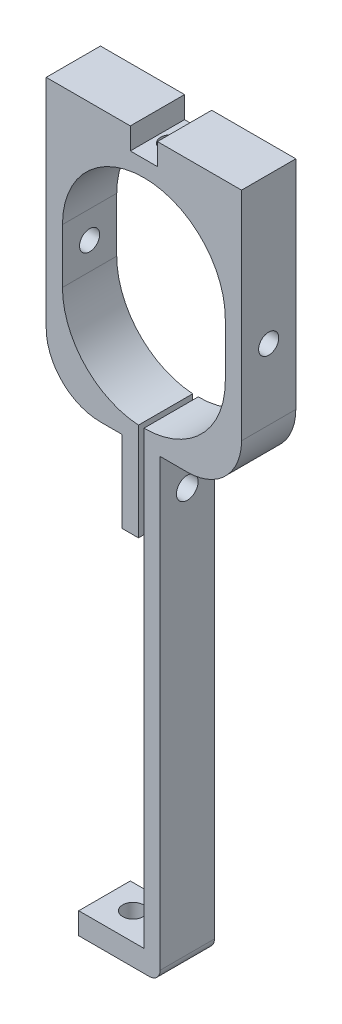
from build123d import *

# Parameters (mm, degrees)
BOSS_EXTRUDE2_DEPTH      = 10
CUT_EXTRUDE2_DEPTH       = 90.877694674
CUT_EXTRUDE2_DEPTH_BACK  = 90.877694674
SKETCH5_W                = 11
SKETCH5_H                = 67.407766248
CUT_EXTRUDE3_DEPTH       = 87.446515257
CUT_EXTRUDE3_DEPTH_BACK  = 87.446515257
SKETCH16_R               = 1.85
FILLET16_R               = 15
CUT_EXTRUDE20_DEPTH      = 92.021975369
CUT_EXTRUDE20_DEPTH_BACK = 92.021975369
SKETCH45_R               = 1.85
SKETCH52_W               = 15
SKETCH52_H               = 10
BOSS_EXTRUDE25_DEPTH     = 4
FILLET17_R               = 10
FILLET18_R               = 2
SKETCH53_R               = 1.9
CUT_EXTRUDE25_DEPTH      = 10
SKETCH55_W               = 0.5
SKETCH55_H               = 4
CUT_EXTRUDE28_DEPTH      = 10
SKETCH56_W               = 10
SKETCH56_H               = 4
BOSS_EXTRUDE26_DEPTH     = 36
SKETCH57_R               = 1.9
CUT_EXTRUDE29_DEPTH      = 36
SKETCH59_W               = 5
SKETCH59_H               = 10
CUT_EXTRUDE31_DEPTH      = 4
CUT_EXTRUDE32_DEPTH      = 91.05553843
CUT_EXTRUDE32_DEPTH_BACK = 91.05553843
SKETCH60_R               = 2


with BuildPart() as part:
    # Sketch2 → Boss-Extrude2 (new body)
    with BuildSketch(Plane.XY):
        Polygon((18, -3), (33, -3), (33, 43), (-3, 43), (-3, -3), (11, -3), (11, -83), (18, -83), align=None)
        Polygon((15, 0), (30, 0), (30, 40), (0, 40), (0, 0), (14, 0), (14, -80), (15, -80), align=None, mode=Mode.SUBTRACT)
    extrude(amount=BOSS_EXTRUDE2_DEPTH)

    # Sketch5 → Cut-Extrude2 (cut, two sides: drawn at the far end of the back side and taken through both)
    with BuildSketch(Plane.XY.offset(10).offset(-CUT_EXTRUDE2_DEPTH_BACK)):
        with Locations((9.5, -51.703883124)):
            Rectangle(SKETCH5_W, SKETCH5_H)
    extrude(amount=CUT_EXTRUDE2_DEPTH + CUT_EXTRUDE2_DEPTH_BACK, mode=Mode.SUBTRACT)

    # Sketch16 → Cut-Extrude3 (cut, two sides: drawn at the far end of the back side and taken through both)
    with BuildSketch(Plane.ZY.offset(-11).offset(-CUT_EXTRUDE3_DEPTH_BACK)):
        with Locations((5, -10.5)):
            Circle(SKETCH16_R)
    extrude(amount=CUT_EXTRUDE3_DEPTH + CUT_EXTRUDE3_DEPTH_BACK, mode=Mode.SUBTRACT)

    # Fillet16
    # the kernel refuses this fillet: 15 mm, written as the material it adds along each edge
    with BuildSketch(Plane(origin=(0, 40, 0), x_dir=(0, -1, 0), z_dir=(0, 0, 1)), Plane(origin=(30, 40, 0), x_dir=(-1, 0, 0), z_dir=(0, 0, 1)), Plane(origin=(30, 0, 0), x_dir=(0, 1, 0), z_dir=(0, 0, 1))) as fillet16_piece_1:
        with BuildLine():
            CenterArc((FILLET16_R, FILLET16_R), FILLET16_R, 180, 90)
            Line((0, FILLET16_R), (-FILLET16_R * 0.02, FILLET16_R))
            Line((-FILLET16_R * 0.02, FILLET16_R), (-FILLET16_R * 0.02, -FILLET16_R * 0.02))
            Line((-FILLET16_R * 0.02, -FILLET16_R * 0.02), (FILLET16_R, -FILLET16_R * 0.02))
            Line((FILLET16_R, -FILLET16_R * 0.02), (FILLET16_R, 0))
        make_face()
    extrude(amount=10)
    with BuildSketch(Plane(origin=(0, 0, 0), x_dir=(1, 0, 0), z_dir=(0, 0, 1))) as fillet16_piece_2:
        with BuildLine():
            CenterArc((15, 14.966629547), FILLET16_R, 180, 86.177446271)
            Line((0, 14.966629547), (-0.3, 14.966629547))
            Line((-0.3, 14.966629547), (-0.3, 0))
            Line((-0.3, 0), (0, -0.3))
            ThreePointArc((0, -0.3), (7, -0.3), (13.98, -0.299332591))
            Line((13.98, -0.299332591), (14, 0))
        make_face()
    extrude(amount=10)

    # Sketch45 → Cut-Extrude20 (cut, two sides: drawn at the far end of the back side and taken through both)
    with BuildSketch(Plane.ZY.offset(3).offset(-CUT_EXTRUDE20_DEPTH_BACK)):
        with Locations((5, 20)):
            Circle(SKETCH45_R)
    extrude(amount=CUT_EXTRUDE20_DEPTH + CUT_EXTRUDE20_DEPTH_BACK, mode=Mode.SUBTRACT)

    # Sketch52 → Boss-Extrude25 (add)
    with BuildSketch(Plane.XZ.offset(83)):
        with Locations((10.5, 5)):
            Rectangle(SKETCH52_W, SKETCH52_H)
    extrude(amount=BOSS_EXTRUDE25_DEPTH)

    # Fillet17
    fillet17_edges = [part.edges().sort_by_distance(p)[0] for p in [
        (-3, -3, 5),
        (33, -3, 5),
    ]]
    fillet(fillet17_edges, radius=FILLET17_R)

    # Fillet18
    fillet18_edges = [part.edges().sort_by_distance(p)[0] for p in [
        (18, -87, 5),
    ]]
    fillet(fillet18_edges, radius=FILLET18_R)

    # Sketch53 → Cut-Extrude25 (cut)
    with BuildSketch(Plane.XZ.offset(87)):
        with Locations(Location((8, 5, 0), (0, 0, 270))):
            Circle(SKETCH53_R)
    extrude(amount=-CUT_EXTRUDE25_DEPTH, mode=Mode.SUBTRACT)

    # Sketch55 → Cut-Extrude28 (cut)
    with BuildSketch(Plane.ZY.offset(-3)):
        with Locations((0.25, -85)):
            Rectangle(SKETCH55_W, SKETCH55_H)
    extrude(amount=-CUT_EXTRUDE28_DEPTH, mode=Mode.SUBTRACT)

    # Sketch56 → Boss-Extrude26 (add)
    with BuildSketch(Plane.ZY.offset(3)):
        with Locations((5, 45)):
            Rectangle(SKETCH56_W, SKETCH56_H)
    extrude(amount=-BOSS_EXTRUDE26_DEPTH)

    # Sketch57 → Cut-Extrude29 (cut)
    with BuildSketch(Plane(origin=(0, 47, 0), x_dir=(1, 0, 0), z_dir=(0, 1, 0))):
        with Locations(Location((15, -5, 0), (0, 0, 270))):
            Circle(SKETCH57_R)
    extrude(amount=-CUT_EXTRUDE29_DEPTH, mode=Mode.SUBTRACT)

    # Sketch59 → Cut-Extrude31 (cut)
    with BuildSketch(Plane(origin=(0, 47, 0), x_dir=(1, 0, 0), z_dir=(0, 1, 0))):
        with Locations((15, -5)):
            Rectangle(SKETCH59_W, SKETCH59_H)
    extrude(amount=-CUT_EXTRUDE31_DEPTH, mode=Mode.SUBTRACT)

    # Sketch60 → Cut-Extrude32 (cut, two sides: drawn at the far end of the back side and taken through both)
    with BuildSketch(Plane(origin=(18, 0, 0), x_dir=(0, 0, -1), z_dir=(1, 0, 0)).offset(-CUT_EXTRUDE32_DEPTH_BACK)):
        with Locations((-5, -10.5)):
            Circle(SKETCH60_R)
    extrude(amount=CUT_EXTRUDE32_DEPTH + CUT_EXTRUDE32_DEPTH_BACK, mode=Mode.SUBTRACT)


solid = part.part
